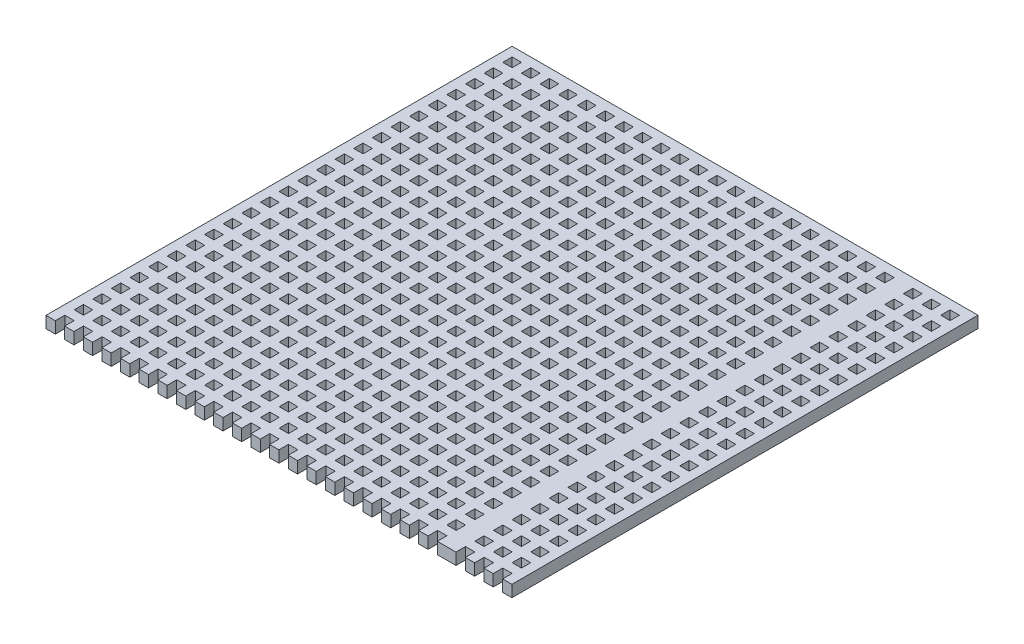
from build123d import *

# Parameters (mm, degrees)
SKETCH2_W           = 98
SKETCH2_H           = 2
SKETCH2_W_2         = 2
BOSS_EXTRUDE1_DEPTH = 2.5
SKETCH3_W           = 2
SKETCH3_H           = 98.049515372
BOSS_EXTRUDE2_DEPTH = 2.5


with BuildPart() as part:
    # Sketch2 → Boss-Extrude1 (new body)
    with BuildSketch(Plane(origin=(0, 0, 0), x_dir=(1, 0, 0), z_dir=(0, 1, 0))):
        with Locations((1, 49)):
            Rectangle(SKETCH2_W, SKETCH2_H)
        with Locations((1, 45)):
            Rectangle(SKETCH2_W, SKETCH2_H)
        with Locations((1, 41)):
            Rectangle(SKETCH2_W, SKETCH2_H)
        with Locations((1, 37)):
            Rectangle(SKETCH2_W, SKETCH2_H)
        with Locations((1, 33)):
            Rectangle(SKETCH2_W, SKETCH2_H)
        with Locations((1, 29)):
            Rectangle(SKETCH2_W, SKETCH2_H)
        with Locations((1, 25)):
            Rectangle(SKETCH2_W, SKETCH2_H)
        with Locations((1, 21)):
            Rectangle(SKETCH2_W, SKETCH2_H)
        with Locations((1, 17)):
            Rectangle(SKETCH2_W, SKETCH2_H)
        with Locations((1, 13)):
            Rectangle(SKETCH2_W, SKETCH2_H)
        with Locations((1, 9)):
            Rectangle(SKETCH2_W, SKETCH2_H)
        with Locations((1, 5)):
            Rectangle(SKETCH2_W, SKETCH2_H)
        with Locations((1, 1)):
            Rectangle(SKETCH2_W, SKETCH2_H)
        with Locations((1, -3)):
            Rectangle(SKETCH2_W, SKETCH2_H)
        with Locations((1, -7)):
            Rectangle(SKETCH2_W, SKETCH2_H)
        with Locations((1, -11)):
            Rectangle(SKETCH2_W, SKETCH2_H)
        with Locations((1, -15)):
            Rectangle(SKETCH2_W, SKETCH2_H)
        with Locations((1, -19)):
            Rectangle(SKETCH2_W, SKETCH2_H)
        with Locations((1, -23)):
            Rectangle(SKETCH2_W, SKETCH2_H)
        with Locations((1, -27)):
            Rectangle(SKETCH2_W, SKETCH2_H)
        with Locations((1, -31)):
            Rectangle(SKETCH2_W, SKETCH2_H)
        with Locations((1, -35)):
            Rectangle(SKETCH2_W, SKETCH2_H)
        with Locations((1, -39)):
            Rectangle(SKETCH2_W, SKETCH2_H)
        with Locations((1, -43)):
            Rectangle(SKETCH2_W, SKETCH2_H)
        with Locations((1, -47)):
            Rectangle(SKETCH2_W, SKETCH2_H)
        with Locations((-49, 49)):
            Rectangle(SKETCH2_W_2, SKETCH2_H)
        with Locations((-49, 45)):
            Rectangle(SKETCH2_W_2, SKETCH2_H)
        with Locations((-49, 41)):
            Rectangle(SKETCH2_W_2, SKETCH2_H)
        with Locations((-49, 37)):
            Rectangle(SKETCH2_W_2, SKETCH2_H)
        with Locations((-49, 33)):
            Rectangle(SKETCH2_W_2, SKETCH2_H)
        with Locations((-49, 29)):
            Rectangle(SKETCH2_W_2, SKETCH2_H)
        with Locations((-49, 25)):
            Rectangle(SKETCH2_W_2, SKETCH2_H)
        with Locations((-49, 21)):
            Rectangle(SKETCH2_W_2, SKETCH2_H)
        with Locations((-49, 17)):
            Rectangle(SKETCH2_W_2, SKETCH2_H)
        with Locations((-49, 13)):
            Rectangle(SKETCH2_W_2, SKETCH2_H)
        with Locations((-49, 9)):
            Rectangle(SKETCH2_W_2, SKETCH2_H)
        with Locations((-49, 5)):
            Rectangle(SKETCH2_W_2, SKETCH2_H)
        with Locations((-49, 1)):
            Rectangle(SKETCH2_W_2, SKETCH2_H)
        with Locations((-49, -3)):
            Rectangle(SKETCH2_W_2, SKETCH2_H)
        with Locations((-49, -7)):
            Rectangle(SKETCH2_W_2, SKETCH2_H)
        with Locations((-49, -11)):
            Rectangle(SKETCH2_W_2, SKETCH2_H)
        with Locations((-49, -15)):
            Rectangle(SKETCH2_W_2, SKETCH2_H)
        with Locations((-49, -19)):
            Rectangle(SKETCH2_W_2, SKETCH2_H)
        with Locations((-49, -23)):
            Rectangle(SKETCH2_W_2, SKETCH2_H)
        with Locations((-49, -27)):
            Rectangle(SKETCH2_W_2, SKETCH2_H)
        with Locations((-49, -31)):
            Rectangle(SKETCH2_W_2, SKETCH2_H)
        with Locations((-49, -35)):
            Rectangle(SKETCH2_W_2, SKETCH2_H)
        with Locations((-49, -39)):
            Rectangle(SKETCH2_W_2, SKETCH2_H)
        with Locations((-49, -43)):
            Rectangle(SKETCH2_W_2, SKETCH2_H)
        with Locations((-49, -47)):
            Rectangle(SKETCH2_W_2, SKETCH2_H)
    extrude(amount=BOSS_EXTRUDE1_DEPTH)

    # Sketch3 → Boss-Extrude2 (add)
    with BuildSketch(Plane(origin=(0, 2.5, 0), x_dir=(1, 0, 0), z_dir=(0, 1, 0))):
        with Locations((49, -1.024757686)):
            Rectangle(SKETCH3_W, SKETCH3_H)
        with Locations((45, -1.024757686)):
            Rectangle(SKETCH3_W, SKETCH3_H)
        with Locations((41, -1.024757686)):
            Rectangle(SKETCH3_W, SKETCH3_H)
        with Locations((37, -1.024757686)):
            Rectangle(SKETCH3_W, SKETCH3_H)
        with Locations((35, -1.024757686)):
            Rectangle(SKETCH3_W, SKETCH3_H)
        with Locations((31, -1.024757686)):
            Rectangle(SKETCH3_W, SKETCH3_H)
        with Locations((27, -1.024757686)):
            Rectangle(SKETCH3_W, SKETCH3_H)
        with Locations((23, -1.024757686)):
            Rectangle(SKETCH3_W, SKETCH3_H)
        with Locations((19, -1.024757686)):
            Rectangle(SKETCH3_W, SKETCH3_H)
        with Locations((15, -1.024757686)):
            Rectangle(SKETCH3_W, SKETCH3_H)
        with Locations((11, -1.024757686)):
            Rectangle(SKETCH3_W, SKETCH3_H)
        with Locations((7, -1.024757686)):
            Rectangle(SKETCH3_W, SKETCH3_H)
        with Locations((3, -1.024757686)):
            Rectangle(SKETCH3_W, SKETCH3_H)
        with Locations((-1, -1.024757686)):
            Rectangle(SKETCH3_W, SKETCH3_H)
        with Locations((-5, -1.024757686)):
            Rectangle(SKETCH3_W, SKETCH3_H)
        with Locations((-9, -1.024757686)):
            Rectangle(SKETCH3_W, SKETCH3_H)
        with Locations((-13, -1.024757686)):
            Rectangle(SKETCH3_W, SKETCH3_H)
        with Locations((-17, -1.024757686)):
            Rectangle(SKETCH3_W, SKETCH3_H)
        with Locations((-21, -1.024757686)):
            Rectangle(SKETCH3_W, SKETCH3_H)
        with Locations((-25, -1.024757686)):
            Rectangle(SKETCH3_W, SKETCH3_H)
        with Locations((-29, -1.024757686)):
            Rectangle(SKETCH3_W, SKETCH3_H)
        with Locations((-33, -1.024757686)):
            Rectangle(SKETCH3_W, SKETCH3_H)
        with Locations((-37, -1.024757686)):
            Rectangle(SKETCH3_W, SKETCH3_H)
        with Locations((-41, -1.024757686)):
            Rectangle(SKETCH3_W, SKETCH3_H)
        with Locations((-45, -1.024757686)):
            Rectangle(SKETCH3_W, SKETCH3_H)
        with Locations((-49, -1.024757686)):
            Rectangle(SKETCH3_W, SKETCH3_H)
    extrude(amount=-BOSS_EXTRUDE2_DEPTH)


solid = part.part
